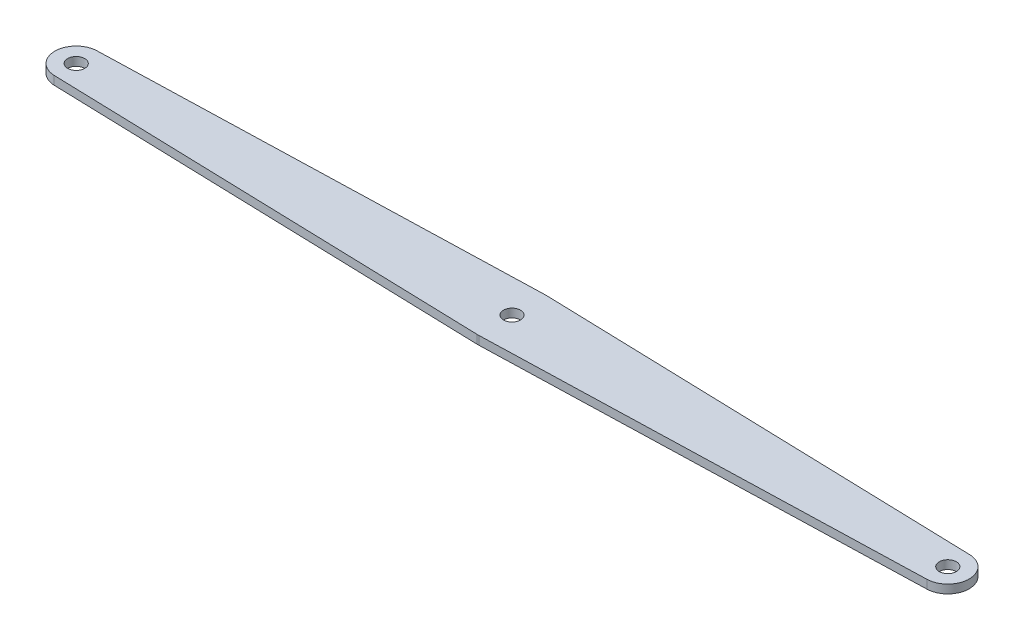
from build123d import *

# Parameters (mm, degrees)
EXTRUDE_428_DEPTH     = 2
SKETCH_2_R            = 2
CUT_EXTRUDE_621_DEPTH = 108.317286585
SKETCH_3_R            = 2
CUT_EXTRUDE_829_DEPTH = 108.317286585


with BuildPart() as part:
    # Эскиз1 → Extrude 428 (new body)
    with BuildSketch(Plane(origin=(0, 0, 0), x_dir=(1, 0, 0), z_dir=(0, 1, 0))):
        with BuildLine():
            Line((-102.147058824, 4.997836902), (-0.235294118, 7.996539044))
            ThreePointArc((-0.235294118, 7.996539044), (0, 8), (0.235294118, 7.996539044))
            Line((0.235294118, 7.996539044), (102.147058824, 4.997836902))
            ThreePointArc((102.147058824, 4.997836902), (107, 0), (102.147058824, -4.997836902))
            Line((102.147058824, -4.997836902), (0.235294118, -7.996539044))
            ThreePointArc((0.235294118, -7.996539044), (0, -8), (-0.235294118, -7.996539044))
            Line((-0.235294118, -7.996539044), (-102.147058824, -4.997836902))
            ThreePointArc((-102.147058824, -4.997836902), (-107, 0), (-102.147058824, 4.997836902))
        make_face()
    extrude(amount=EXTRUDE_428_DEPTH)

    # Эскиз2 → Cut-Extrude 621 (cut, through all)
    with BuildSketch(Plane(origin=(0, 2, 0), x_dir=(1, 0, 0), z_dir=(0, 1, 0))):
        Circle(SKETCH_2_R)
    extrude(amount=-CUT_EXTRUDE_621_DEPTH, mode=Mode.SUBTRACT)

    # Эскиз3 → Cut-Extrude 829 (cut, through all)
    with BuildSketch(Plane(origin=(0, 2, 0), x_dir=(1, 0, 0), z_dir=(0, 1, 0))):
        with Locations((-102, 0)):
            Circle(SKETCH_3_R)
        with Locations((102, 0)):
            Circle(SKETCH_3_R)
    extrude(amount=-CUT_EXTRUDE_829_DEPTH, mode=Mode.SUBTRACT)


solid = part.part
